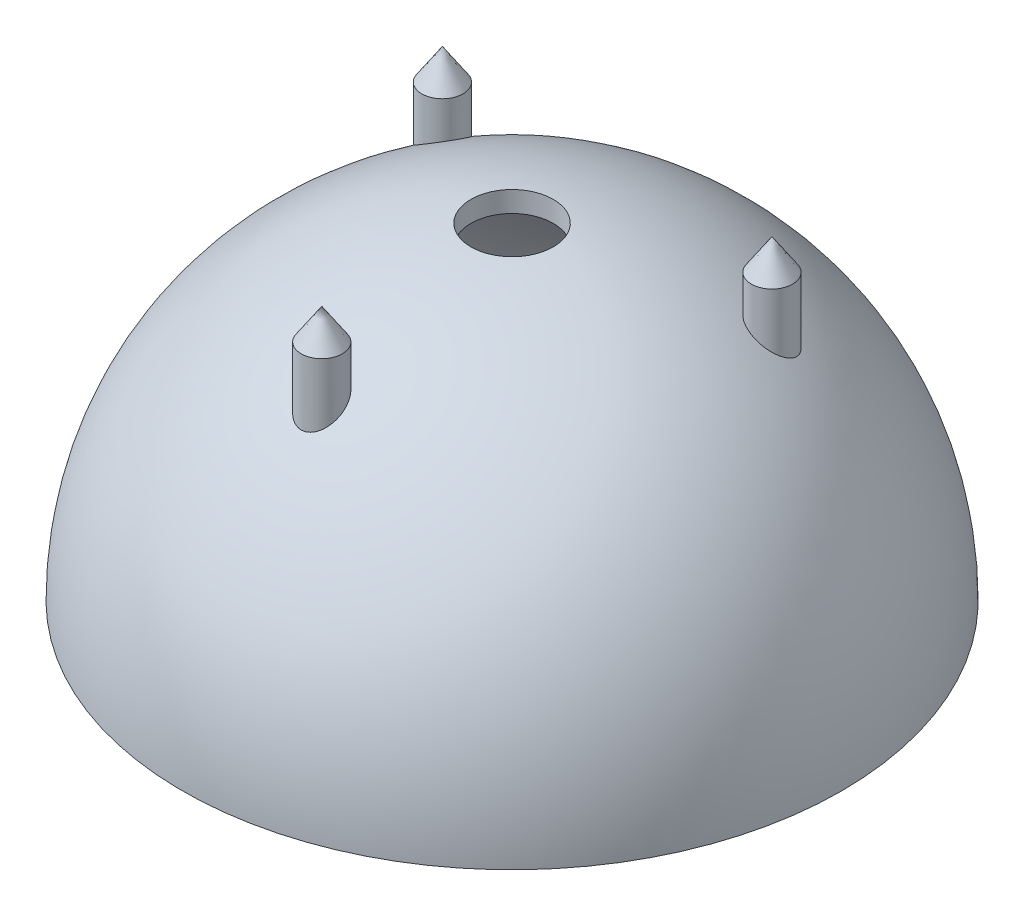
from build123d import *

# Parameters (mm, degrees)
EXTRUDE1_REACH      = 71.665
EXTRUDE1_END_RADIUS = 38.1
SKETCH2_R           = 2.54
SKETCH4_R           = 5.08
EXTRUDE3_DEPTH      = 71.39054482
CIRPATTERN1_COUNT   = 3


with BuildPart() as part:
    # Sketch1 → Revolve1 (revolve)
    with BuildSketch(Plane.XY):
        with BuildLine():
            Line((38.1, 0), (40.64, 0))
            ThreePointArc((40.64, 0), (28.736819587, 28.736819587), (0, 40.64))
            Line((0, 40.64), (0, 38.1))
            ThreePointArc((0, 38.1), (26.940768363, 26.940768363), (38.1, 0))
        make_face()
    revolve(axis=Axis((0, 38.1, 0), (0, 1, 0)))

    # Extrude1: up to this sphere (the profile starts outside it)
    extrude1_end = Location((0, 0, 0)) * Sphere(EXTRUDE1_END_RADIUS, mode=Mode.PRIVATE)
    # Sketch2 → Extrude1 (add, up to the surface)
    with BuildSketch(Plane.XZ.offset(-39.37), mode=Mode.PRIVATE) as extrude1_sk1:
        with Locations((0, 23.46351494)):
            Circle(SKETCH2_R)
    extrude1_tool1 = extrude(extrude1_sk1.sketch, amount=EXTRUDE1_REACH, mode=Mode.PRIVATE) - extrude1_end
    add(extrude1_tool1.solids().sort_by_distance((0, 39.37, 23.463515))[0])
    # Sketch2 → Extrude1 (add, up to the surface)
    with BuildSketch(Plane.XZ.offset(-39.37), mode=Mode.PRIVATE) as extrude1_sk2:
        with Locations((-20.32, -11.73175747)):
            Circle(SKETCH2_R)
    extrude1_tool2 = extrude(extrude1_sk2.sketch, amount=EXTRUDE1_REACH, mode=Mode.PRIVATE) - extrude1_end
    add(extrude1_tool2.solids().sort_by_distance((-20.32, 39.37, -11.731757))[0])
    # Sketch2 → Extrude1 (add, up to the surface)
    with BuildSketch(Plane.XZ.offset(-39.37), mode=Mode.PRIVATE) as extrude1_sk3:
        with Locations((20.32, -11.73175747)):
            Circle(SKETCH2_R)
    extrude1_tool3 = extrude(extrude1_sk3.sketch, amount=EXTRUDE1_REACH, mode=Mode.PRIVATE) - extrude1_end
    add(extrude1_tool3.solids().sort_by_distance((20.32, 39.37, -11.731757))[0])

    # Sketch4 → Extrude3 (cut, through all)
    with BuildSketch(Plane.XZ):
        Circle(SKETCH4_R)
    extrude(amount=-EXTRUDE3_DEPTH, mode=Mode.SUBTRACT)

    # Sketch5 → Revolve2 (revolve)
    with BuildSketch(Plane(origin=(0, 0, 0), x_dir=(0, 0, -1), z_dir=(1, 0, 0))):
        Polygon((-20.92351494, 39.37), (-23.46351494, 43.18), (-23.46351494, 39.37), align=None)
    revolve2 = revolve(axis=Axis((0, 39.37, 23.46351494), (0, 1, 0)))

    # CirPattern1: Revolve2 ×3 about axis
    cirpattern1_axis = Axis((0, 0, 0), (0, -1, 0))
    for i in range(1, CIRPATTERN1_COUNT):
        add(revolve2.rotate(cirpattern1_axis, i * 360 / CIRPATTERN1_COUNT))


solid = part.part
